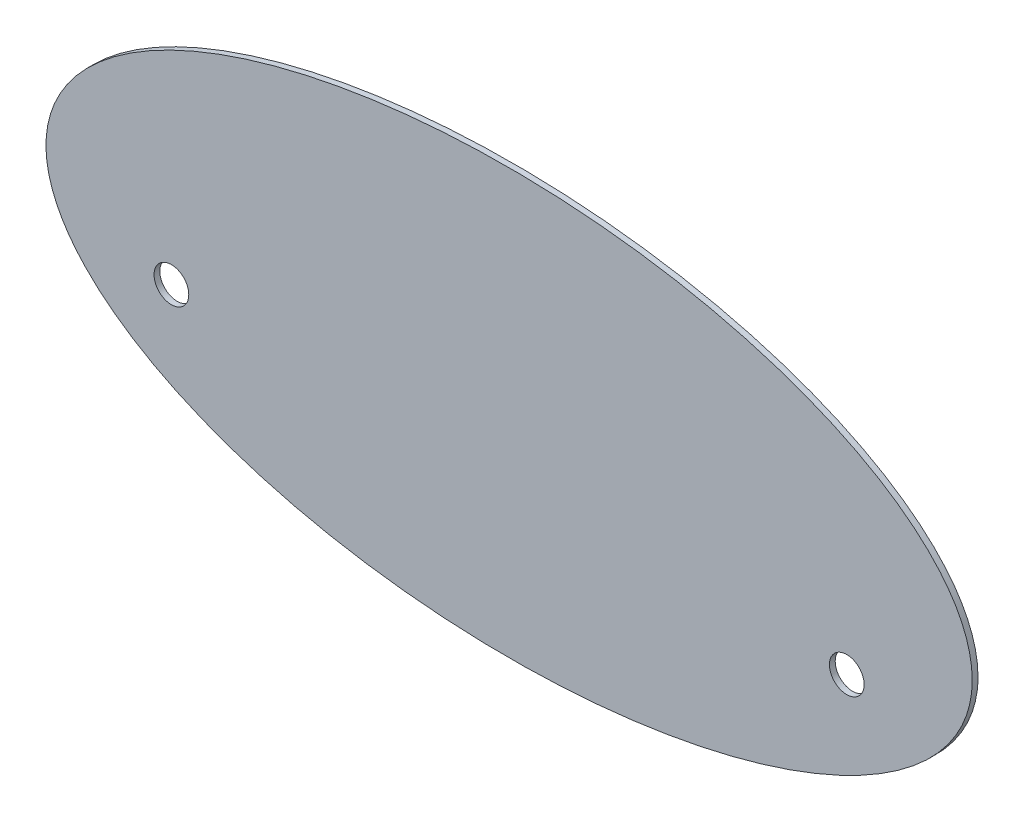
from build123d import *

# Parameters (mm, degrees)
SKETCH1_RX              = 240
SKETCH1_RY              = 110
BOSS_EXTRUDE1_DEPTH     = 3
CUT_EXTRUDE1_DEPTH      = 265.024620064
CUT_EXTRUDE1_DEPTH_BACK = 265.024620064
SKETCH2_R               = 9


with BuildPart() as part:
    # Sketch1 → Boss-Extrude1 (new body)
    with BuildSketch(Plane.XY):
        with Locations((0, 0)):
            Ellipse(SKETCH1_RX, SKETCH1_RY)
    extrude(amount=BOSS_EXTRUDE1_DEPTH)

    # Sketch2 → Cut-Extrude1 (cut, two sides: drawn at the far end of the back side and taken through both)
    with BuildSketch(Plane.XY.offset(-CUT_EXTRUDE1_DEPTH_BACK)):
        with Locations((-175, -30)):
            Circle(SKETCH2_R)
        with Locations((175, -30)):
            Circle(SKETCH2_R)
    extrude(amount=CUT_EXTRUDE1_DEPTH + CUT_EXTRUDE1_DEPTH_BACK, mode=Mode.SUBTRACT)


solid = part.part
